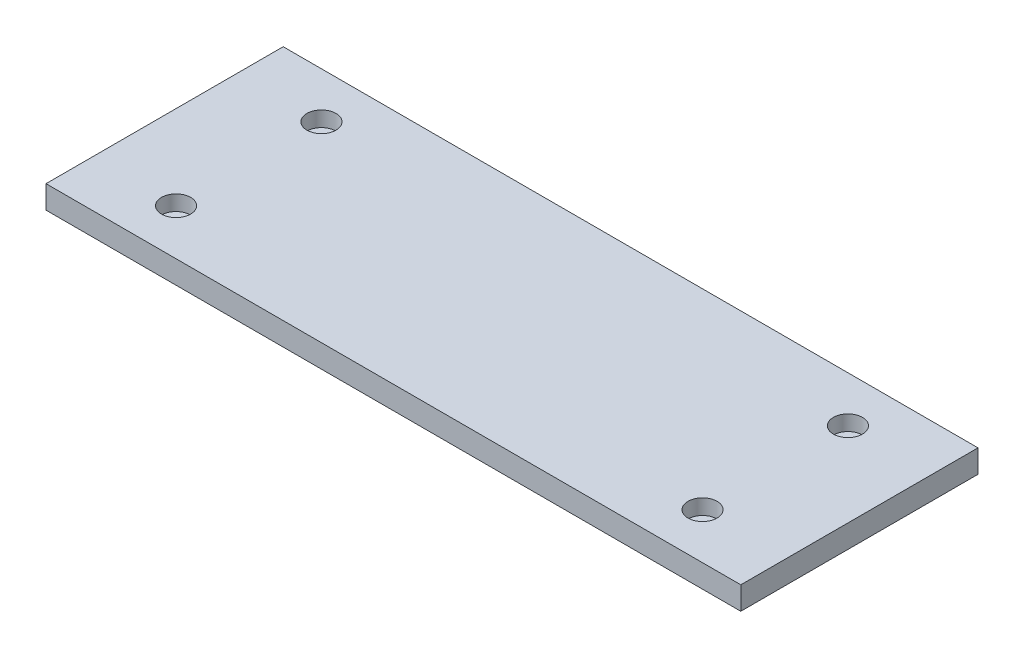
from build123d import *

# Parameters (mm, degrees)
SKETCH1_W           = 90.8
SKETCH1_H           = 31
BOSS_EXTRUDE1_DEPTH = 3
SKETCH2_R           = 0.95
CUT_EXTRUDE1_DEPTH  = 3
SKETCH3_R           = 1.9
CUT_EXTRUDE2_DEPTH  = 2
SKETCH4_W           = 54
SKETCH4_H           = 7
BOSS_EXTRUDE2_DEPTH = 6
SKETCH5_R           = 3.9
CUT_EXTRUDE3_DEPTH  = 54


with BuildPart() as part:
    # Sketch1 → Boss-Extrude1 (new body)
    with BuildSketch(Plane(origin=(0, 0, 0), x_dir=(1, 0, 0), z_dir=(0, 1, 0))):
        Rectangle(SKETCH1_W, SKETCH1_H)
    extrude(amount=BOSS_EXTRUDE1_DEPTH)

    # Sketch2 → Cut-Extrude1 (cut)
    with BuildSketch(Plane(origin=(0, 3, 0), x_dir=(1, 0, 0), z_dir=(0, 1, 0))):
        with Locations((-34.4, 9.5)):
            Circle(SKETCH2_R)
        with Locations((34.4, 9.5)):
            Circle(SKETCH2_R)
        with Locations((-34.4, -9.5)):
            Circle(SKETCH2_R)
        with Locations((34.4, -9.5)):
            Circle(SKETCH2_R)
    extrude(amount=-CUT_EXTRUDE1_DEPTH, mode=Mode.SUBTRACT)

    # Sketch3 → Cut-Extrude2 (cut)
    with BuildSketch(Plane(origin=(0, 3, 0), x_dir=(1, 0, 0), z_dir=(0, 1, 0))):
        with Locations((-34.4, 9.5)):
            Circle(SKETCH3_R)
        with Locations((-34.4, -9.5)):
            Circle(SKETCH3_R)
        with Locations((34.4, 9.5)):
            Circle(SKETCH3_R)
        with Locations((34.4, -9.5)):
            Circle(SKETCH3_R)
    extrude(amount=-CUT_EXTRUDE2_DEPTH, mode=Mode.SUBTRACT)

    # Sketch4 → Boss-Extrude2 (add)
    with BuildSketch(Plane.XZ):
        Rectangle(SKETCH4_W, SKETCH4_H)
    extrude(amount=BOSS_EXTRUDE2_DEPTH)

    # Sketch5 → Cut-Extrude3 (cut)
    with BuildSketch(Plane(origin=(27, 0, 0), x_dir=(0, 0, -1), z_dir=(1, 0, 0))):
        with Locations((0, -7.130658567)):
            Circle(SKETCH5_R)
    extrude(amount=-CUT_EXTRUDE3_DEPTH, mode=Mode.SUBTRACT)


solid = part.part
